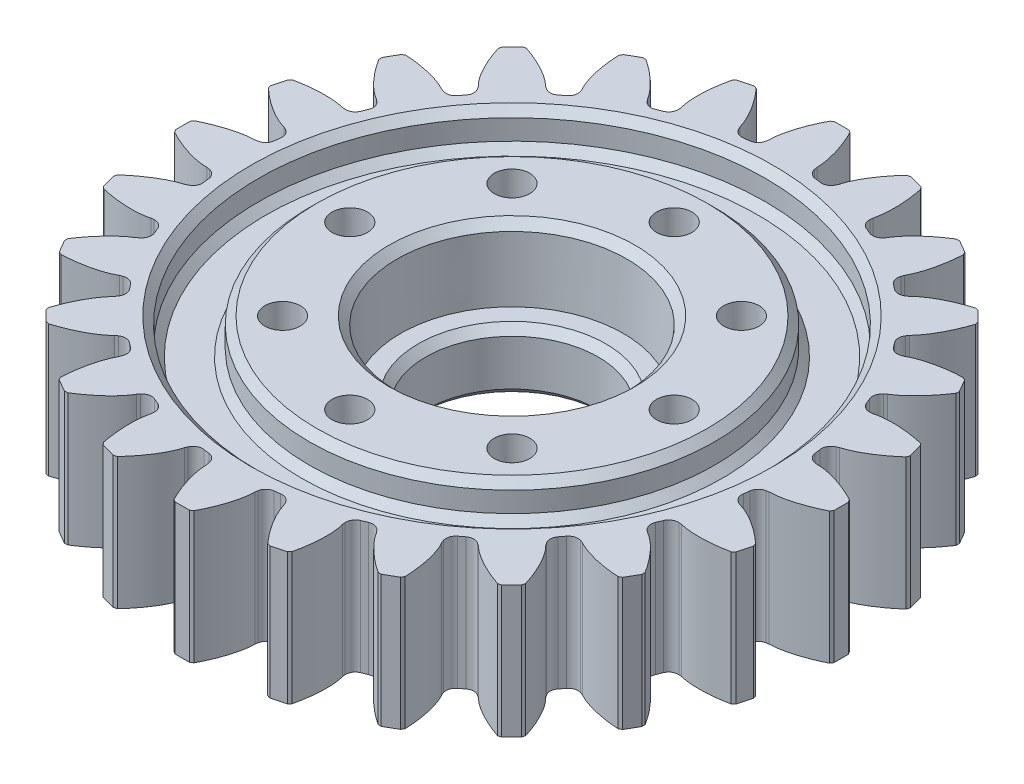
from build123d import *
from OCP.BRepFilletAPI import BRepFilletAPI_MakeChamfer

# Parameters (mm, degrees)
SKETCH1_R                      = 26.875
BOSS_EXTRUDE1_DEPTH            = 13
BOSS_EXTRUDE2_DEPTH            = 13
FILLET2_R                      = 0.95
CHAMFER4_SIZE                  = 0.2
CHAMFER4_SIZE_2                = 0.191025901
CHAMFER4_SIZE_3                = 0.183994077
CIRPATTERN5_COUNT              = 24
FILLET2_OF_CIRPATTERN5_R       = 0.95
CHAMFER4_OF_CIRPATTERN5_SIZE   = 0.191025901
CHAMFER4_OF_CIRPATTERN5_SIZE_2 = 0.2
CHAMFER4_OF_CIRPATTERN5_SIZE_3 = 0.183994077
SKETCH2_R                      = 11
SKETCH2_R_2                    = 8.5
CUT_EXTRUDE1_DEPTH             = 7
CUT_EXTRUDE2_REACH             = 49.765
SKETCH2_3_R                    = 8.5
DRAFT1_ANGLE                   = 3
CHAMFER2_SIZE                  = 0.75
CHAMFER2_SIZE2                 = 0.792565877
CUT_EXTRUDE3_REACH             = 49.765
SKETCH3_R                      = 1.75
CIRPATTERN6_COUNT              = 8
SKETCH4_R                      = 25
SKETCH4_R_2                    = 20
CUT_EXTRUDE4_DEPTH             = 3.5
CHAMFER3_SIZE                  = 0.75


# Read off the part's stored shape, not the designer's step: Boss-Extrude2
with BuildPart() as part:
    # Sketch1 → Boss-Extrude1 (new body)
    with BuildSketch(Plane(origin=(0, 0, 0), x_dir=(1, 0, 0), z_dir=(0, 1, 0))):
        with Locations(Location((0, 0, 0), (0, 0, 90))):
            Circle(SKETCH1_R)
    extrude(amount=BOSS_EXTRUDE1_DEPTH)

    # Boss-Extrude2 outline → Boss-Extrude2 (add)
    with BuildSketch(Plane(origin=(0, 0, 0), x_dir=(1, 0, 0), z_dir=(0, 1, 0))):
        with BuildLine():
            add(Edge.make_bspline(
                [(-2.353242343, 27.725311098), (-2.353777175, 27.73275912), (-2.354994143, 27.753670105), (-2.356176588, 27.793283103), (-2.356516212, 27.858012348), (-2.354611175, 27.940602796), (-2.349463108, 28.047449882), (-2.339943674, 28.173409126), (-2.325862241, 28.311888787), (-2.30663632, 28.46256233), (-2.284002475, 28.612858005), (-2.258211392, 28.762730594), (-2.229622555, 28.911955904), (-2.191571494, 29.092595045), (-2.141190645, 29.309007623), (-2.075386216, 29.561587421), (-1.992597897, 29.847537909), (-1.899519936, 30.138293469), (-1.800785434, 30.423798054), (-1.692834657, 30.711449628), (-1.582582751, 30.989183594), (-1.45970454, 31.27668537), (-1.342026661, 31.541575595), (-1.200967434, 31.837127406), (-1.084437857, 32.075292807), (-0.956403218, 32.320206226), (-0.892958325, 32.439240437), (-0.860059955, 32.5)],
                knots=[0, 0, 0, 0, 0, 0.005376749, 0.015083688, 0.02853182, 0.04661014, 0.064854849, 0.092110526, 0.119476176, 0.146842496, 0.174208854, 0.201574956, 0.228941013, 0.256307345, 0.307035032, 0.361767352, 0.416499661, 0.471231937, 0.525964282, 0.580696616, 0.635428982, 0.690161387, 0.744893688, 0.799626082, 0.854358407, 0.909087317, 0.909087317, 0.909087317, 0.909087317, 0.909087317], degree=4))
            Line((-2.353242343, 27.725311098), (-2.524122138, 26.756203625))
            ThreePointArc((-2.524122138, 26.756203625), (0, 26.875), (2.524122138, 26.756203625))
            Line((2.524122138, 26.756203625), (2.353242343, 27.725311098))
            add(Edge.make_bspline(
                [(2.353242343, 27.725311098), (2.352912452, 27.748265086), (2.351808341, 27.793863744), (2.347960692, 27.906740429), (2.340053473, 28.019848833), (2.327501385, 28.174539712), (2.31054932, 28.322508539), (2.290113822, 28.481064629), (2.266762647, 28.632620459), (2.240473262, 28.787718568), (2.211649787, 28.939857268), (2.180166535, 29.093092711), (2.139100108, 29.278158609), (2.084853302, 29.501524001), (2.016288901, 29.75938366), (1.928761787, 30.055519392), (1.834607321, 30.349752144), (1.730406294, 30.647907249), (1.624762562, 30.933765753), (1.504682728, 31.233439826), (1.392293835, 31.504169427), (1.25196874, 31.816168188), (1.143229189, 32.053451215), (1.011920707, 32.319349405), (0.951932778, 32.438679696), (0.920583202, 32.5)],
                knots=[0.027432107, 0.027432107, 0.027432107, 0.027432107, 0.027432107, 0.045712776, 0.064752973, 0.092175157, 0.119597659, 0.147019427, 0.174441721, 0.201863861, 0.229285851, 0.25670816, 0.284130115, 0.311552276, 0.363142416, 0.417986577, 0.472830799, 0.527675044, 0.582519261, 0.637363569, 0.692207704, 0.747051933, 0.801896229, 0.856740442, 0.911580816, 0.911580816, 0.911580816, 0.911580816, 0.911580816], degree=4))
            Line((0.920583202, 32.5), (-0.860059955, 32.5))
        make_face()
    boss_extrude2 = extrude(amount=BOSS_EXTRUDE2_DEPTH)

    # Fillet2
    fillet2_edges = [part.edges().sort_by_distance(p)[0] for p in [
        (-2.524122138, 6.5, -26.756203625),
        (2.524122138, 6.5, -26.756203625),
    ]]
    fillet(fillet2_edges, radius=FILLET2_R)

    # Chamfer4
    chamfer4_edges_1 = [part.edges().sort_by_distance(p)[0] for p in [
        (-0.860059955, 6.5, -32.5),
    ]]
    chamfer4_side_1 = [part.faces().sort_by_distance(p)[0] for p in [
        (-0.861879045, 6.5, -32.496640347),
    ]]
    chamfer4_edges_2 = [part.edges().sort_by_distance(p)[0] for p in [
        (0.920583202, 6.5, -32.5),
    ]]
    chamfer4_side_2 = [part.faces().sort_by_distance(p)[0] for p in [
        (0.922258299, 6.5, -32.496723481),
    ]]
    chamfer4 = BRepFilletAPI_MakeChamfer(part.part.solid().wrapped)
    for e in chamfer4_edges_1:
        chamfer4.Add(CHAMFER4_SIZE - 0.0004, CHAMFER4_SIZE_2 - 0.0004, e.wrapped, chamfer4_side_1[0].wrapped)
    for e in chamfer4_edges_2:
        chamfer4.Add(CHAMFER4_SIZE - 0.0004, CHAMFER4_SIZE_3 - 0.0004, e.wrapped, chamfer4_side_2[0].wrapped)
    add(Compound.cast(chamfer4.Shape()), mode=Mode.REPLACE)  # a hair under: the kernel refuses the full size

    # CirPattern5: Boss-Extrude2 ×24 about axis
    cirpattern5_axis = Axis((0, 13, 0), (0, 1, 0))
    for i in range(1, CIRPATTERN5_COUNT):
        add(boss_extrude2.rotate(cirpattern5_axis, i * 360 / CIRPATTERN5_COUNT))

    # Fillet2 of CirPattern5
    fillet2_of_cirpattern5_edges = [part.edges().sort_by_distance(p)[0] for p in [
        (-9.363129835, 6.5, -25.191217213),
        (-4.486900311, 6.5, -26.497798976),
        (-15.564055706, 6.5, -21.909490979),
        (-11.192147919, 6.5, -24.433613117),
        (-20.704316902, 6.5, -17.134669142),
        (-17.134669142, 6.5, -20.704316902),
        (-24.433613117, 6.5, -11.192147919),
        (-21.909490979, 6.5, -15.564055706),
        (-26.497798976, 6.5, -4.486900311),
        (-25.191217213, 6.5, -9.363129835),
        (-26.756203625, 6.5, 2.524122138),
        (-26.756203625, 6.5, -2.524122138),
        (-25.191217213, 6.5, 9.363129835),
        (-26.497798976, 6.5, 4.486900311),
        (-21.909490979, 6.5, 15.564055706),
        (-24.433613117, 6.5, 11.192147919),
        (-17.134669142, 6.5, 20.704316902),
        (-20.704316902, 6.5, 17.134669142),
        (-11.192147919, 6.5, 24.433613117),
        (-15.564055706, 6.5, 21.909490979),
        (-4.486900311, 6.5, 26.497798976),
        (-9.363129835, 6.5, 25.191217213),
        (2.524122138, 6.5, 26.756203625),
        (-2.524122138, 6.5, 26.756203625),
        (9.363129835, 6.5, 25.191217213),
        (4.486900311, 6.5, 26.497798976),
        (15.564055706, 6.5, 21.909490979),
        (11.192147919, 6.5, 24.433613117),
        (20.704316902, 6.5, 17.134669142),
        (17.134669142, 6.5, 20.704316902),
        (24.433613117, 6.5, 11.192147919),
        (21.909490979, 6.5, 15.564055706),
        (26.497798976, 6.5, 4.486900311),
        (25.191217213, 6.5, 9.363129835),
        (26.756203625, 6.5, -2.524122138),
        (26.756203625, 6.5, 2.524122138),
        (25.191217213, 6.5, -9.363129835),
        (26.497798976, 6.5, -4.486900311),
        (21.909490979, 6.5, -15.564055706),
        (24.433613117, 6.5, -11.192147919),
        (17.134669142, 6.5, -20.704316902),
        (20.704316902, 6.5, -17.134669142),
        (11.192147919, 6.5, -24.433613117),
        (15.564055706, 6.5, -21.909490979),
        (4.486900311, 6.5, -26.497798976),
        (9.363129835, 6.5, -25.191217213),
    ]]
    fillet(fillet2_of_cirpattern5_edges, radius=FILLET2_OF_CIRPATTERN5_R)

    # Chamfer4 of CirPattern5
    chamfer4_of_cirpattern5_edges_1 = [part.edges().sort_by_distance(p)[0] for p in [
        (-9.242373089, 6.5, -31.169989458),
    ]]
    chamfer4_of_cirpattern5_side_1 = [part.faces().sort_by_distance(p)[0] for p in [
        (-9.238682751, 6.5, -31.170978281),
    ]]
    chamfer4_of_cirpattern5_edges_2 = [part.edges().sort_by_distance(p)[0] for p in [
        (-7.522403876, 6.5, -31.63085382),
    ]]
    chamfer4_of_cirpattern5_side_2 = [part.faces().sort_by_distance(p)[0] for p in [
        (-7.51993783, 6.5, -31.628122492),
    ]]
    chamfer4_of_cirpattern5_edges_3 = [part.edges().sort_by_distance(p)[0] for p in [
        (-16.99483377, 6.5, -27.715795645),
    ]]
    chamfer4_of_cirpattern5_side_3 = [part.faces().sort_by_distance(p)[0] for p in [
        (-16.991525104, 6.5, -27.717705905),
    ]]
    chamfer4_of_cirpattern5_edges_4 = [part.edges().sort_by_distance(p)[0] for p in [
        (-15.452751561, 6.5, -28.606117224),
    ]]
    chamfer4_of_cirpattern5_side_4 = [part.faces().sort_by_distance(p)[0] for p in [
        (-15.449662624, 6.5, -28.604117224),
    ]]
    chamfer4_of_cirpattern5_edges_5 = [part.edges().sort_by_distance(p)[0] for p in [
        (-23.589124615, 6.5, -22.372816162),
    ]]
    chamfer4_of_cirpattern5_side_5 = [part.faces().sort_by_distance(p)[0] for p in [
        (-23.586423101, 6.5, -22.375517676),
    ]]
    chamfer4_of_cirpattern5_edges_6 = [part.edges().sort_by_distance(p)[0] for p in [
        (-22.330019764, 6.5, -23.631921013),
    ]]
    chamfer4_of_cirpattern5_side_6 = [part.faces().sort_by_distance(p)[0] for p in [
        (-22.326518442, 6.5, -23.630788637),
    ]]
    chamfer4_of_cirpattern5_edges_7 = [part.edges().sort_by_distance(p)[0] for p in [
        (-28.5758556, 6.5, -15.50516623),
    ]]
    chamfer4_of_cirpattern5_side_7 = [part.faces().sort_by_distance(p)[0] for p in [
        (-28.573945341, 6.5, -15.508474896),
    ]]
    chamfer4_of_cirpattern5_edges_8 = [part.edges().sort_by_distance(p)[0] for p in [
        (-27.685534022, 6.5, -17.047248439),
    ]]
    chamfer4_of_cirpattern5_side_8 = [part.faces().sort_by_distance(p)[0] for p in [
        (-27.681858925, 6.5, -17.047060857),
    ]]
    chamfer4_of_cirpattern5_edges_9 = [part.edges().sort_by_distance(p)[0] for p in [
        (-31.615189251, 6.5, -7.580864843),
    ]]
    chamfer4_of_cirpattern5_side_9 = [part.faces().sort_by_distance(p)[0] for p in [
        (-31.614200428, 6.5, -7.58455518),
    ]]
    chamfer4_of_cirpattern5_edges_10 = [part.edges().sort_by_distance(p)[0] for p in [
        (-31.154324889, 6.5, -9.300834056),
    ]]
    chamfer4_of_cirpattern5_side_10 = [part.faces().sort_by_distance(p)[0] for p in [
        (-31.150726468, 6.5, -9.30160405),
    ]]
    chamfer4_of_cirpattern5_edges_11 = [part.edges().sort_by_distance(p)[0] for p in [
        (-32.5, 6.5, 0.860059955),
    ]]
    chamfer4_of_cirpattern5_side_11 = [part.faces().sort_by_distance(p)[0] for p in [
        (-32.5, 6.5, 0.856239437),
    ]]
    chamfer4_of_cirpattern5_edges_12 = [part.edges().sort_by_distance(p)[0] for p in [
        (-32.5, 6.5, -0.920583202),
    ]]
    chamfer4_of_cirpattern5_side_12 = [part.faces().sort_by_distance(p)[0] for p in [
        (-32.496723481, 6.5, -0.922258299),
    ]]
    chamfer4_of_cirpattern5_edges_13 = [part.edges().sort_by_distance(p)[0] for p in [
        (-31.169989458, 6.5, 9.242373089),
    ]]
    chamfer4_of_cirpattern5_side_13 = [part.faces().sort_by_distance(p)[0] for p in [
        (-31.170978281, 6.5, 9.238682751),
    ]]
    chamfer4_of_cirpattern5_edges_14 = [part.edges().sort_by_distance(p)[0] for p in [
        (-31.63085382, 6.5, 7.522403876),
    ]]
    chamfer4_of_cirpattern5_side_14 = [part.faces().sort_by_distance(p)[0] for p in [
        (-31.628122492, 6.5, 7.51993783),
    ]]
    chamfer4_of_cirpattern5_edges_15 = [part.edges().sort_by_distance(p)[0] for p in [
        (-27.715795645, 6.5, 16.99483377),
    ]]
    chamfer4_of_cirpattern5_side_15 = [part.faces().sort_by_distance(p)[0] for p in [
        (-27.717705905, 6.5, 16.991525104),
    ]]
    chamfer4_of_cirpattern5_edges_16 = [part.edges().sort_by_distance(p)[0] for p in [
        (-28.606117224, 6.5, 15.452751561),
    ]]
    chamfer4_of_cirpattern5_side_16 = [part.faces().sort_by_distance(p)[0] for p in [
        (-28.604117224, 6.5, 15.449662624),
    ]]
    chamfer4_of_cirpattern5_edges_17 = [part.edges().sort_by_distance(p)[0] for p in [
        (-22.372816162, 6.5, 23.589124615),
    ]]
    chamfer4_of_cirpattern5_side_17 = [part.faces().sort_by_distance(p)[0] for p in [
        (-22.375517676, 6.5, 23.586423101),
    ]]
    chamfer4_of_cirpattern5_edges_18 = [part.edges().sort_by_distance(p)[0] for p in [
        (-23.631921013, 6.5, 22.330019764),
    ]]
    chamfer4_of_cirpattern5_side_18 = [part.faces().sort_by_distance(p)[0] for p in [
        (-23.630788637, 6.5, 22.326518442),
    ]]
    chamfer4_of_cirpattern5_edges_19 = [part.edges().sort_by_distance(p)[0] for p in [
        (-15.50516623, 6.5, 28.5758556),
    ]]
    chamfer4_of_cirpattern5_side_19 = [part.faces().sort_by_distance(p)[0] for p in [
        (-15.508474896, 6.5, 28.573945341),
    ]]
    chamfer4_of_cirpattern5_edges_20 = [part.edges().sort_by_distance(p)[0] for p in [
        (-17.047248439, 6.5, 27.685534022),
    ]]
    chamfer4_of_cirpattern5_side_20 = [part.faces().sort_by_distance(p)[0] for p in [
        (-17.047060857, 6.5, 27.681858925),
    ]]
    chamfer4_of_cirpattern5_edges_21 = [part.edges().sort_by_distance(p)[0] for p in [
        (-7.580864843, 6.5, 31.615189251),
    ]]
    chamfer4_of_cirpattern5_side_21 = [part.faces().sort_by_distance(p)[0] for p in [
        (-7.58455518, 6.5, 31.614200428),
    ]]
    chamfer4_of_cirpattern5_edges_22 = [part.edges().sort_by_distance(p)[0] for p in [
        (-9.300834056, 6.5, 31.154324889),
    ]]
    chamfer4_of_cirpattern5_side_22 = [part.faces().sort_by_distance(p)[0] for p in [
        (-9.30160405, 6.5, 31.150726468),
    ]]
    chamfer4_of_cirpattern5_edges_23 = [part.edges().sort_by_distance(p)[0] for p in [
        (0.860059955, 6.5, 32.5),
    ]]
    chamfer4_of_cirpattern5_side_23 = [part.faces().sort_by_distance(p)[0] for p in [
        (0.856239437, 6.5, 32.5),
    ]]
    chamfer4_of_cirpattern5_edges_24 = [part.edges().sort_by_distance(p)[0] for p in [
        (-0.920583202, 6.5, 32.5),
    ]]
    chamfer4_of_cirpattern5_side_24 = [part.faces().sort_by_distance(p)[0] for p in [
        (-0.922258299, 6.5, 32.496723481),
    ]]
    chamfer4_of_cirpattern5_edges_25 = [part.edges().sort_by_distance(p)[0] for p in [
        (9.242373089, 6.5, 31.169989458),
    ]]
    chamfer4_of_cirpattern5_side_25 = [part.faces().sort_by_distance(p)[0] for p in [
        (9.243260652, 6.5, 31.166273467),
    ]]
    chamfer4_of_cirpattern5_edges_26 = [part.edges().sort_by_distance(p)[0] for p in [
        (7.522403876, 6.5, 31.63085382),
    ]]
    chamfer4_of_cirpattern5_side_26 = [part.faces().sort_by_distance(p)[0] for p in [
        (7.525958368, 6.5, 31.629901396),
    ]]
    chamfer4_of_cirpattern5_edges_27 = [part.edges().sort_by_distance(p)[0] for p in [
        (16.99483377, 6.5, 27.715795645),
    ]]
    chamfer4_of_cirpattern5_side_27 = [part.faces().sort_by_distance(p)[0] for p in [
        (16.994729321, 6.5, 27.711976555),
    ]]
    chamfer4_of_cirpattern5_edges_28 = [part.edges().sort_by_distance(p)[0] for p in [
        (15.452751561, 6.5, 28.606117224),
    ]]
    chamfer4_of_cirpattern5_side_28 = [part.faces().sort_by_distance(p)[0] for p in [
        (15.455938432, 6.5, 28.604277283),
    ]]
    chamfer4_of_cirpattern5_edges_29 = [part.edges().sort_by_distance(p)[0] for p in [
        (23.589124615, 6.5, 22.372816162),
    ]]
    chamfer4_of_cirpattern5_side_29 = [part.faces().sort_by_distance(p)[0] for p in [
        (23.588035272, 6.5, 22.369154238),
    ]]
    chamfer4_of_cirpattern5_edges_30 = [part.edges().sort_by_distance(p)[0] for p in [
        (22.330019764, 6.5, 23.631921013),
    ]]
    chamfer4_of_cirpattern5_side_30 = [part.faces().sort_by_distance(p)[0] for p in [
        (22.332621833, 6.5, 23.629318944),
    ]]
    chamfer4_of_cirpattern5_edges_31 = [part.edges().sort_by_distance(p)[0] for p in [
        (28.5758556, 6.5, 15.50516623),
    ]]
    chamfer4_of_cirpattern5_side_31 = [part.faces().sort_by_distance(p)[0] for p in [
        (28.5738556, 6.5, 15.501911025),
    ]]
    chamfer4_of_cirpattern5_edges_32 = [part.edges().sort_by_distance(p)[0] for p in [
        (27.685534022, 6.5, 17.047248439),
    ]]
    chamfer4_of_cirpattern5_side_32 = [part.faces().sort_by_distance(p)[0] for p in [
        (27.687373963, 6.5, 17.044061568),
    ]]
    chamfer4_of_cirpattern5_edges_33 = [part.edges().sort_by_distance(p)[0] for p in [
        (31.615189251, 6.5, 7.580864843),
    ]]
    chamfer4_of_cirpattern5_side_33 = [part.faces().sort_by_distance(p)[0] for p in [
        (31.61241489, 6.5, 7.578238195),
    ]]
    chamfer4_of_cirpattern5_edges_34 = [part.edges().sort_by_distance(p)[0] for p in [
        (31.154324889, 6.5, 9.300834056),
    ]]
    chamfer4_of_cirpattern5_side_34 = [part.faces().sort_by_distance(p)[0] for p in [
        (31.155277313, 6.5, 9.297279563),
    ]]
    chamfer4_of_cirpattern5_edges_35 = [part.edges().sort_by_distance(p)[0] for p in [
        (32.5, 6.5, -0.860059955),
    ]]
    chamfer4_of_cirpattern5_side_35 = [part.faces().sort_by_distance(p)[0] for p in [
        (32.496640347, 6.5, -0.861879045),
    ]]
    chamfer4_of_cirpattern5_edges_36 = [part.edges().sort_by_distance(p)[0] for p in [
        (32.5, 6.5, 0.920583202),
    ]]
    chamfer4_of_cirpattern5_side_36 = [part.faces().sort_by_distance(p)[0] for p in [
        (32.5, 6.5, 0.91690332),
    ]]
    chamfer4_of_cirpattern5_edges_37 = [part.edges().sort_by_distance(p)[0] for p in [
        (31.169989458, 6.5, -9.242373089),
    ]]
    chamfer4_of_cirpattern5_side_37 = [part.faces().sort_by_distance(p)[0] for p in [
        (31.166273467, 6.5, -9.243260652),
    ]]
    chamfer4_of_cirpattern5_edges_38 = [part.edges().sort_by_distance(p)[0] for p in [
        (31.63085382, 6.5, -7.522403876),
    ]]
    chamfer4_of_cirpattern5_side_38 = [part.faces().sort_by_distance(p)[0] for p in [
        (31.629901396, 6.5, -7.525958368),
    ]]
    chamfer4_of_cirpattern5_edges_39 = [part.edges().sort_by_distance(p)[0] for p in [
        (27.715795645, 6.5, -16.99483377),
    ]]
    chamfer4_of_cirpattern5_side_39 = [part.faces().sort_by_distance(p)[0] for p in [
        (27.711976555, 6.5, -16.994729321),
    ]]
    chamfer4_of_cirpattern5_edges_40 = [part.edges().sort_by_distance(p)[0] for p in [
        (28.606117224, 6.5, -15.452751561),
    ]]
    chamfer4_of_cirpattern5_side_40 = [part.faces().sort_by_distance(p)[0] for p in [
        (28.604277283, 6.5, -15.455938432),
    ]]
    chamfer4_of_cirpattern5_edges_41 = [part.edges().sort_by_distance(p)[0] for p in [
        (22.372816162, 6.5, -23.589124615),
    ]]
    chamfer4_of_cirpattern5_side_41 = [part.faces().sort_by_distance(p)[0] for p in [
        (22.369154238, 6.5, -23.588035272),
    ]]
    chamfer4_of_cirpattern5_edges_42 = [part.edges().sort_by_distance(p)[0] for p in [
        (23.631921013, 6.5, -22.330019764),
    ]]
    chamfer4_of_cirpattern5_side_42 = [part.faces().sort_by_distance(p)[0] for p in [
        (23.629318944, 6.5, -22.332621833),
    ]]
    chamfer4_of_cirpattern5_edges_43 = [part.edges().sort_by_distance(p)[0] for p in [
        (15.50516623, 6.5, -28.5758556),
    ]]
    chamfer4_of_cirpattern5_side_43 = [part.faces().sort_by_distance(p)[0] for p in [
        (15.501911025, 6.5, -28.5738556),
    ]]
    chamfer4_of_cirpattern5_edges_44 = [part.edges().sort_by_distance(p)[0] for p in [
        (17.047248439, 6.5, -27.685534022),
    ]]
    chamfer4_of_cirpattern5_side_44 = [part.faces().sort_by_distance(p)[0] for p in [
        (17.044061568, 6.5, -27.687373963),
    ]]
    chamfer4_of_cirpattern5_edges_45 = [part.edges().sort_by_distance(p)[0] for p in [
        (7.580864843, 6.5, -31.615189251),
    ]]
    chamfer4_of_cirpattern5_side_45 = [part.faces().sort_by_distance(p)[0] for p in [
        (7.578238195, 6.5, -31.61241489),
    ]]
    chamfer4_of_cirpattern5_edges_46 = [part.edges().sort_by_distance(p)[0] for p in [
        (9.300834056, 6.5, -31.154324889),
    ]]
    chamfer4_of_cirpattern5_side_46 = [part.faces().sort_by_distance(p)[0] for p in [
        (9.297279563, 6.5, -31.155277313),
    ]]
    chamfer4_of_cirpattern5 = BRepFilletAPI_MakeChamfer(part.part.solid().wrapped)
    for e in chamfer4_of_cirpattern5_edges_1:
        chamfer4_of_cirpattern5.Add(CHAMFER4_OF_CIRPATTERN5_SIZE - 0.0004, CHAMFER4_OF_CIRPATTERN5_SIZE_2 - 0.0004, e.wrapped, chamfer4_of_cirpattern5_side_1[0].wrapped)
    for e in chamfer4_of_cirpattern5_edges_2:
        chamfer4_of_cirpattern5.Add(CHAMFER4_OF_CIRPATTERN5_SIZE_2 - 0.0004, CHAMFER4_OF_CIRPATTERN5_SIZE_3 - 0.0004, e.wrapped, chamfer4_of_cirpattern5_side_2[0].wrapped)
    for e in chamfer4_of_cirpattern5_edges_3:
        chamfer4_of_cirpattern5.Add(CHAMFER4_OF_CIRPATTERN5_SIZE - 0.0004, CHAMFER4_OF_CIRPATTERN5_SIZE_2 - 0.0004, e.wrapped, chamfer4_of_cirpattern5_side_3[0].wrapped)
    for e in chamfer4_of_cirpattern5_edges_4:
        chamfer4_of_cirpattern5.Add(CHAMFER4_OF_CIRPATTERN5_SIZE_2 - 0.0004, CHAMFER4_OF_CIRPATTERN5_SIZE_3 - 0.0004, e.wrapped, chamfer4_of_cirpattern5_side_4[0].wrapped)
    for e in chamfer4_of_cirpattern5_edges_5:
        chamfer4_of_cirpattern5.Add(CHAMFER4_OF_CIRPATTERN5_SIZE - 0.0004, CHAMFER4_OF_CIRPATTERN5_SIZE_2 - 0.0004, e.wrapped, chamfer4_of_cirpattern5_side_5[0].wrapped)
    for e in chamfer4_of_cirpattern5_edges_6:
        chamfer4_of_cirpattern5.Add(CHAMFER4_OF_CIRPATTERN5_SIZE_2 - 0.0004, CHAMFER4_OF_CIRPATTERN5_SIZE_3 - 0.0004, e.wrapped, chamfer4_of_cirpattern5_side_6[0].wrapped)
    for e in chamfer4_of_cirpattern5_edges_7:
        chamfer4_of_cirpattern5.Add(CHAMFER4_OF_CIRPATTERN5_SIZE - 0.0004, CHAMFER4_OF_CIRPATTERN5_SIZE_2 - 0.0004, e.wrapped, chamfer4_of_cirpattern5_side_7[0].wrapped)
    for e in chamfer4_of_cirpattern5_edges_8:
        chamfer4_of_cirpattern5.Add(CHAMFER4_OF_CIRPATTERN5_SIZE_2 - 0.0004, CHAMFER4_OF_CIRPATTERN5_SIZE_3 - 0.0004, e.wrapped, chamfer4_of_cirpattern5_side_8[0].wrapped)
    for e in chamfer4_of_cirpattern5_edges_9:
        chamfer4_of_cirpattern5.Add(CHAMFER4_OF_CIRPATTERN5_SIZE - 0.0004, CHAMFER4_OF_CIRPATTERN5_SIZE_2 - 0.0004, e.wrapped, chamfer4_of_cirpattern5_side_9[0].wrapped)
    for e in chamfer4_of_cirpattern5_edges_10:
        chamfer4_of_cirpattern5.Add(CHAMFER4_OF_CIRPATTERN5_SIZE_2 - 0.0004, CHAMFER4_OF_CIRPATTERN5_SIZE_3 - 0.0004, e.wrapped, chamfer4_of_cirpattern5_side_10[0].wrapped)
    for e in chamfer4_of_cirpattern5_edges_11:
        chamfer4_of_cirpattern5.Add(CHAMFER4_OF_CIRPATTERN5_SIZE - 0.0004, CHAMFER4_OF_CIRPATTERN5_SIZE_2 - 0.0004, e.wrapped, chamfer4_of_cirpattern5_side_11[0].wrapped)
    for e in chamfer4_of_cirpattern5_edges_12:
        chamfer4_of_cirpattern5.Add(CHAMFER4_OF_CIRPATTERN5_SIZE_2 - 0.0004, CHAMFER4_OF_CIRPATTERN5_SIZE_3 - 0.0004, e.wrapped, chamfer4_of_cirpattern5_side_12[0].wrapped)
    for e in chamfer4_of_cirpattern5_edges_13:
        chamfer4_of_cirpattern5.Add(CHAMFER4_OF_CIRPATTERN5_SIZE - 0.0004, CHAMFER4_OF_CIRPATTERN5_SIZE_2 - 0.0004, e.wrapped, chamfer4_of_cirpattern5_side_13[0].wrapped)
    for e in chamfer4_of_cirpattern5_edges_14:
        chamfer4_of_cirpattern5.Add(CHAMFER4_OF_CIRPATTERN5_SIZE_2 - 0.0004, CHAMFER4_OF_CIRPATTERN5_SIZE_3 - 0.0004, e.wrapped, chamfer4_of_cirpattern5_side_14[0].wrapped)
    for e in chamfer4_of_cirpattern5_edges_15:
        chamfer4_of_cirpattern5.Add(CHAMFER4_OF_CIRPATTERN5_SIZE - 0.0004, CHAMFER4_OF_CIRPATTERN5_SIZE_2 - 0.0004, e.wrapped, chamfer4_of_cirpattern5_side_15[0].wrapped)
    for e in chamfer4_of_cirpattern5_edges_16:
        chamfer4_of_cirpattern5.Add(CHAMFER4_OF_CIRPATTERN5_SIZE_2 - 0.0004, CHAMFER4_OF_CIRPATTERN5_SIZE_3 - 0.0004, e.wrapped, chamfer4_of_cirpattern5_side_16[0].wrapped)
    for e in chamfer4_of_cirpattern5_edges_17:
        chamfer4_of_cirpattern5.Add(CHAMFER4_OF_CIRPATTERN5_SIZE - 0.0004, CHAMFER4_OF_CIRPATTERN5_SIZE_2 - 0.0004, e.wrapped, chamfer4_of_cirpattern5_side_17[0].wrapped)
    for e in chamfer4_of_cirpattern5_edges_18:
        chamfer4_of_cirpattern5.Add(CHAMFER4_OF_CIRPATTERN5_SIZE_2 - 0.0004, CHAMFER4_OF_CIRPATTERN5_SIZE_3 - 0.0004, e.wrapped, chamfer4_of_cirpattern5_side_18[0].wrapped)
    for e in chamfer4_of_cirpattern5_edges_19:
        chamfer4_of_cirpattern5.Add(CHAMFER4_OF_CIRPATTERN5_SIZE - 0.0004, CHAMFER4_OF_CIRPATTERN5_SIZE_2 - 0.0004, e.wrapped, chamfer4_of_cirpattern5_side_19[0].wrapped)
    for e in chamfer4_of_cirpattern5_edges_20:
        chamfer4_of_cirpattern5.Add(CHAMFER4_OF_CIRPATTERN5_SIZE_2 - 0.0004, CHAMFER4_OF_CIRPATTERN5_SIZE_3 - 0.0004, e.wrapped, chamfer4_of_cirpattern5_side_20[0].wrapped)
    for e in chamfer4_of_cirpattern5_edges_21:
        chamfer4_of_cirpattern5.Add(CHAMFER4_OF_CIRPATTERN5_SIZE - 0.0004, CHAMFER4_OF_CIRPATTERN5_SIZE_2 - 0.0004, e.wrapped, chamfer4_of_cirpattern5_side_21[0].wrapped)
    for e in chamfer4_of_cirpattern5_edges_22:
        chamfer4_of_cirpattern5.Add(CHAMFER4_OF_CIRPATTERN5_SIZE_2 - 0.0004, CHAMFER4_OF_CIRPATTERN5_SIZE_3 - 0.0004, e.wrapped, chamfer4_of_cirpattern5_side_22[0].wrapped)
    for e in chamfer4_of_cirpattern5_edges_23:
        chamfer4_of_cirpattern5.Add(CHAMFER4_OF_CIRPATTERN5_SIZE - 0.0004, CHAMFER4_OF_CIRPATTERN5_SIZE_2 - 0.0004, e.wrapped, chamfer4_of_cirpattern5_side_23[0].wrapped)
    for e in chamfer4_of_cirpattern5_edges_24:
        chamfer4_of_cirpattern5.Add(CHAMFER4_OF_CIRPATTERN5_SIZE_2 - 0.0004, CHAMFER4_OF_CIRPATTERN5_SIZE_3 - 0.0004, e.wrapped, chamfer4_of_cirpattern5_side_24[0].wrapped)
    for e in chamfer4_of_cirpattern5_edges_25:
        chamfer4_of_cirpattern5.Add(CHAMFER4_OF_CIRPATTERN5_SIZE_2 - 0.0004, CHAMFER4_OF_CIRPATTERN5_SIZE - 0.0004, e.wrapped, chamfer4_of_cirpattern5_side_25[0].wrapped)
    for e in chamfer4_of_cirpattern5_edges_26:
        chamfer4_of_cirpattern5.Add(CHAMFER4_OF_CIRPATTERN5_SIZE_3 - 0.0004, CHAMFER4_OF_CIRPATTERN5_SIZE_2 - 0.0004, e.wrapped, chamfer4_of_cirpattern5_side_26[0].wrapped)
    for e in chamfer4_of_cirpattern5_edges_27:
        chamfer4_of_cirpattern5.Add(CHAMFER4_OF_CIRPATTERN5_SIZE_2 - 0.0004, CHAMFER4_OF_CIRPATTERN5_SIZE - 0.0004, e.wrapped, chamfer4_of_cirpattern5_side_27[0].wrapped)
    for e in chamfer4_of_cirpattern5_edges_28:
        chamfer4_of_cirpattern5.Add(CHAMFER4_OF_CIRPATTERN5_SIZE_3 - 0.0004, CHAMFER4_OF_CIRPATTERN5_SIZE_2 - 0.0004, e.wrapped, chamfer4_of_cirpattern5_side_28[0].wrapped)
    for e in chamfer4_of_cirpattern5_edges_29:
        chamfer4_of_cirpattern5.Add(CHAMFER4_OF_CIRPATTERN5_SIZE_2 - 0.0004, CHAMFER4_OF_CIRPATTERN5_SIZE - 0.0004, e.wrapped, chamfer4_of_cirpattern5_side_29[0].wrapped)
    for e in chamfer4_of_cirpattern5_edges_30:
        chamfer4_of_cirpattern5.Add(CHAMFER4_OF_CIRPATTERN5_SIZE_3 - 0.0004, CHAMFER4_OF_CIRPATTERN5_SIZE_2 - 0.0004, e.wrapped, chamfer4_of_cirpattern5_side_30[0].wrapped)
    for e in chamfer4_of_cirpattern5_edges_31:
        chamfer4_of_cirpattern5.Add(CHAMFER4_OF_CIRPATTERN5_SIZE_2 - 0.0004, CHAMFER4_OF_CIRPATTERN5_SIZE - 0.0004, e.wrapped, chamfer4_of_cirpattern5_side_31[0].wrapped)
    for e in chamfer4_of_cirpattern5_edges_32:
        chamfer4_of_cirpattern5.Add(CHAMFER4_OF_CIRPATTERN5_SIZE_3 - 0.0004, CHAMFER4_OF_CIRPATTERN5_SIZE_2 - 0.0004, e.wrapped, chamfer4_of_cirpattern5_side_32[0].wrapped)
    for e in chamfer4_of_cirpattern5_edges_33:
        chamfer4_of_cirpattern5.Add(CHAMFER4_OF_CIRPATTERN5_SIZE_2 - 0.0004, CHAMFER4_OF_CIRPATTERN5_SIZE - 0.0004, e.wrapped, chamfer4_of_cirpattern5_side_33[0].wrapped)
    for e in chamfer4_of_cirpattern5_edges_34:
        chamfer4_of_cirpattern5.Add(CHAMFER4_OF_CIRPATTERN5_SIZE_3 - 0.0004, CHAMFER4_OF_CIRPATTERN5_SIZE_2 - 0.0004, e.wrapped, chamfer4_of_cirpattern5_side_34[0].wrapped)
    for e in chamfer4_of_cirpattern5_edges_35:
        chamfer4_of_cirpattern5.Add(CHAMFER4_OF_CIRPATTERN5_SIZE_2 - 0.0004, CHAMFER4_OF_CIRPATTERN5_SIZE - 0.0004, e.wrapped, chamfer4_of_cirpattern5_side_35[0].wrapped)
    for e in chamfer4_of_cirpattern5_edges_36:
        chamfer4_of_cirpattern5.Add(CHAMFER4_OF_CIRPATTERN5_SIZE_3 - 0.0004, CHAMFER4_OF_CIRPATTERN5_SIZE_2 - 0.0004, e.wrapped, chamfer4_of_cirpattern5_side_36[0].wrapped)
    for e in chamfer4_of_cirpattern5_edges_37:
        chamfer4_of_cirpattern5.Add(CHAMFER4_OF_CIRPATTERN5_SIZE_2 - 0.0004, CHAMFER4_OF_CIRPATTERN5_SIZE - 0.0004, e.wrapped, chamfer4_of_cirpattern5_side_37[0].wrapped)
    for e in chamfer4_of_cirpattern5_edges_38:
        chamfer4_of_cirpattern5.Add(CHAMFER4_OF_CIRPATTERN5_SIZE_3 - 0.0004, CHAMFER4_OF_CIRPATTERN5_SIZE_2 - 0.0004, e.wrapped, chamfer4_of_cirpattern5_side_38[0].wrapped)
    for e in chamfer4_of_cirpattern5_edges_39:
        chamfer4_of_cirpattern5.Add(CHAMFER4_OF_CIRPATTERN5_SIZE_2 - 0.0004, CHAMFER4_OF_CIRPATTERN5_SIZE - 0.0004, e.wrapped, chamfer4_of_cirpattern5_side_39[0].wrapped)
    for e in chamfer4_of_cirpattern5_edges_40:
        chamfer4_of_cirpattern5.Add(CHAMFER4_OF_CIRPATTERN5_SIZE_3 - 0.0004, CHAMFER4_OF_CIRPATTERN5_SIZE_2 - 0.0004, e.wrapped, chamfer4_of_cirpattern5_side_40[0].wrapped)
    for e in chamfer4_of_cirpattern5_edges_41:
        chamfer4_of_cirpattern5.Add(CHAMFER4_OF_CIRPATTERN5_SIZE_2 - 0.0004, CHAMFER4_OF_CIRPATTERN5_SIZE - 0.0004, e.wrapped, chamfer4_of_cirpattern5_side_41[0].wrapped)
    for e in chamfer4_of_cirpattern5_edges_42:
        chamfer4_of_cirpattern5.Add(CHAMFER4_OF_CIRPATTERN5_SIZE_3 - 0.0004, CHAMFER4_OF_CIRPATTERN5_SIZE_2 - 0.0004, e.wrapped, chamfer4_of_cirpattern5_side_42[0].wrapped)
    for e in chamfer4_of_cirpattern5_edges_43:
        chamfer4_of_cirpattern5.Add(CHAMFER4_OF_CIRPATTERN5_SIZE_2 - 0.0004, CHAMFER4_OF_CIRPATTERN5_SIZE - 0.0004, e.wrapped, chamfer4_of_cirpattern5_side_43[0].wrapped)
    for e in chamfer4_of_cirpattern5_edges_44:
        chamfer4_of_cirpattern5.Add(CHAMFER4_OF_CIRPATTERN5_SIZE_3 - 0.0004, CHAMFER4_OF_CIRPATTERN5_SIZE_2 - 0.0004, e.wrapped, chamfer4_of_cirpattern5_side_44[0].wrapped)
    for e in chamfer4_of_cirpattern5_edges_45:
        chamfer4_of_cirpattern5.Add(CHAMFER4_OF_CIRPATTERN5_SIZE_2 - 0.0004, CHAMFER4_OF_CIRPATTERN5_SIZE - 0.0004, e.wrapped, chamfer4_of_cirpattern5_side_45[0].wrapped)
    for e in chamfer4_of_cirpattern5_edges_46:
        chamfer4_of_cirpattern5.Add(CHAMFER4_OF_CIRPATTERN5_SIZE_3 - 0.0004, CHAMFER4_OF_CIRPATTERN5_SIZE_2 - 0.0004, e.wrapped, chamfer4_of_cirpattern5_side_46[0].wrapped)
    add(Compound.cast(chamfer4_of_cirpattern5.Shape()), mode=Mode.REPLACE)  # a hair under: the kernel refuses the full size

    # Sketch2 → Cut-Extrude1 (cut)
    # profile 1 of 2: a face of its own
    with BuildSketch(Plane(origin=(0, 13, 0), x_dir=(1, 0, 0), z_dir=(0, 1, 0))):
        with Locations(Location((0, 0, 0), (0, 0, 270))):
            Circle(SKETCH2_R)
        Circle(SKETCH2_R_2, mode=Mode.SUBTRACT)
    # profile 2 of 2: a face of its own
    with BuildSketch(Plane(origin=(0, 13, 0), x_dir=(1, 0, 0), z_dir=(0, 1, 0))):
        Circle(SKETCH2_R_2)
    extrude(amount=-CUT_EXTRUDE1_DEPTH, mode=Mode.SUBTRACT)

    # Sketch2<3> → Cut-Extrude2 (cut, up to next)
    with BuildSketch(Plane(origin=(0, 13, 0), x_dir=(1, 0, 0), z_dir=(0, 1, 0)), mode=Mode.PRIVATE) as cut_extrude2_sk1:
        with Locations(Location((0, 0, 0), (0, 0, 270))):
            Circle(SKETCH2_3_R)
    cut_extrude2_tool1 = extrude(cut_extrude2_sk1.sketch, amount=-CUT_EXTRUDE2_REACH, mode=Mode.PRIVATE) & part.part
    add(cut_extrude2_tool1.solids().sort_by_distance((0, 13, 0))[0], mode=Mode.SUBTRACT)

    # Draft1
    draft1_faces = [part.faces().sort_by_distance(p)[0] for p in [
        (0, 9.5, -11),
    ]]
    draft(draft1_faces, Plane.ZX.offset(6), DRAFT1_ANGLE)

    # Chamfer2: one chamfer whose edges measure the first distance from different faces: ONE call of the kernel's chamfer builder (chamfer() names one face for all edges)
    chamfer2_edges_1 = [part.edges().sort_by_distance(p)[0] for p in [
        (0, 13, -11.366854455),
    ]]
    chamfer2_side_1 = [part.faces().sort_by_distance(p)[0] for p in [
        (-6.713669386, 13, -29.06967885),
    ]]
    chamfer2_edges_2 = [part.edges().sort_by_distance(p)[0] for p in [
        (0, 6, -8.5),
        (0, 0, -8.5),
    ]]
    chamfer2 = BRepFilletAPI_MakeChamfer(part.part.solid().wrapped)
    for e in chamfer2_edges_1:
        chamfer2.Add(CHAMFER2_SIZE, CHAMFER2_SIZE2, e.wrapped, chamfer2_side_1[0].wrapped)  # the first distance lies on this face
    for e in chamfer2_edges_2:
        chamfer2.Add(CHAMFER2_SIZE, e.wrapped)
    add(Compound.cast(chamfer2.Shape()), mode=Mode.REPLACE)

    # Sketch3 → Cut-Extrude3 (cut, up to next)
    with BuildSketch(Plane(origin=(0, 13, 0), x_dir=(1, 0, 0), z_dir=(0, 1, 0)), mode=Mode.PRIVATE) as cut_extrude3_sk1:
        with Locations(Location((0, 16, 0), (0, 0, 270))):
            Circle(SKETCH3_R)
    cut_extrude3_tool1 = extrude(cut_extrude3_sk1.sketch, amount=-CUT_EXTRUDE3_REACH, mode=Mode.PRIVATE) & part.part
    cut_extrude3 = cut_extrude3_tool1.solids().sort_by_distance((0, 13, -16))[0]
    add(cut_extrude3, mode=Mode.SUBTRACT)

    # CirPattern6: Cut-Extrude3 ×8 about axis
    cirpattern6_axis = Axis((0, 0, 0), (0, 1, 0))
    for i in range(1, CIRPATTERN6_COUNT):
        add(cut_extrude3.rotate(cirpattern6_axis, i * 360 / CIRPATTERN6_COUNT), mode=Mode.SUBTRACT)

    # Sketch4 → Cut-Extrude4 (cut)
    with BuildSketch(Plane(origin=(0, 13, 0), x_dir=(1, 0, 0), z_dir=(0, 1, 0))):
        with Locations(Location((0, 0, 0), (0, 0, 270))):
            Circle(SKETCH4_R)
        with Locations(Location((0, 0, 0), (0, 0, 270))):
            Circle(SKETCH4_R_2, mode=Mode.SUBTRACT)
    cut_extrude4 = extrude(amount=-CUT_EXTRUDE4_DEPTH, mode=Mode.SUBTRACT)

    # Mirror1: Cut-Extrude4 across plane
    add(cut_extrude4.mirror(Plane(origin=(0, 6.5, 0), x_dir=(0, 0, 1), z_dir=(0, -1, 0))), mode=Mode.SUBTRACT)

    # Chamfer3
    chamfer3_edges = [part.edges().sort_by_distance(p)[0] for p in [
        (0, 13, -20),
        (0, 9.5, -25),
        (0, 9.5, -20),
        (0, 13, -25),
        (0, 3.5, -20),
        (0, 0, -25),
        (0, 3.5, -25),
        (0, 0, -20),
    ]]
    chamfer(chamfer3_edges, length=CHAMFER3_SIZE)


solid = part.part
